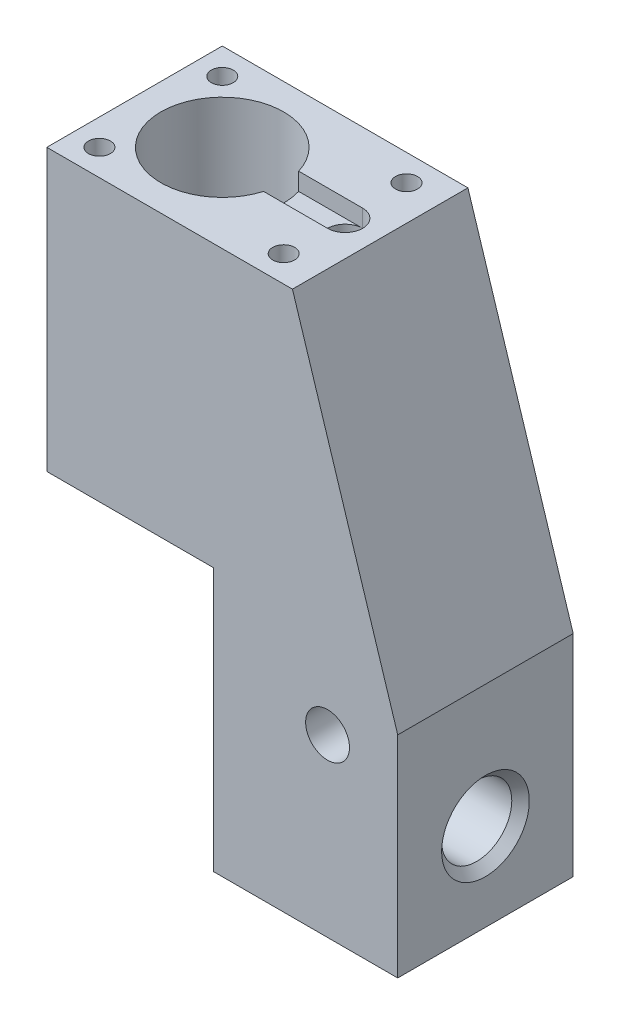
from build123d import *

# Parameters (mm, degrees)
BOSS_EXTRUDE1_DEPTH     = 10
CUT_EXTRUDE1_DEPTH      = 67.219333
CUT_EXTRUDE2_DEPTH      = 2
M3_TAPPED_HOLE1_D       = 2.5
M3_TAPPED_HOLE1_DEPTH   = 9
M3_TAPPED_HOLE1_TIP     = 0.751076
SKETCH5_R               = 2.5
CUT_EXTRUDE3_DEPTH      = 44.185646
SKETCH6_R               = 4
CUT_EXTRUDE4_DEPTH      = 53.191953
CHAMFER1_SIZE           = 1
HOLE1_OUTLINE_R         = 2
HOLE1_DEPTH             = 30
HOLE1_START             = -16.200329
HOLE1_2_OUTLINE_R       = 1.25
HOLE1_2_DEPTH           = 16.200329
CUT_EXTRUDE5_REACH      = 54.192
CUT_EXTRUDE5_END_RADIUS = 7
SKETCH9_R               = 1.6
M4_TAPPED_HOLE1_REACH   = 68.219
M4_TAPPED_HOLE1_BORE_R  = 1.65
CUT_EXTRUDE6_REACH      = 68.219
CUT_EXTRUDE6_END_RADIUS = 2.5
SKETCH13_R              = 1.25


# Read off the part's stored shape, not the designer's step: Hole1
with BuildPart() as part:
    # Sketch1 → Boss-Extrude1 (new, symmetric)
    with BuildSketch(Plane.XY):
        Polygon((0, 0), (-19, 0), (-19, 32), (9, 32), (21, -6), (21, -30), (0, -30), align=None)
    extrude(amount=BOSS_EXTRUDE1_DEPTH, both=True)

    # Sketch2 → Cut-Extrude1 (cut, through all)
    with BuildSketch(Plane(origin=(0, 32, 0), x_dir=(1, 0, 0), z_dir=(0, 1, 0))):
        with BuildLine():
            ThreePointArc((-2.291796, 2), (-10.010587, 6.926667), (-16, 0))
            Line((-16, 0), (-2, 0))
            ThreePointArc((-2, 0), (-2.073333, 1.010587), (-2.291796, 2))
        make_face()
        with BuildLine():
            Line((-2, 0), (-16, 0))
            ThreePointArc((-16, 0), (-10.010587, -6.926667), (-2.291796, -2))
            ThreePointArc((-2.291796, -2), (-2.073333, -1.010587), (-2, 0))
        make_face()
    extrude(amount=-CUT_EXTRUDE1_DEPTH, mode=Mode.SUBTRACT)

    # Sketch2<3> → Cut-Extrude2 (cut)
    with BuildSketch(Plane(origin=(0, 32, 0), x_dir=(1, 0, 0), z_dir=(0, 1, 0))):
        with BuildLine():
            ThreePointArc((-2.291796, 2), (-2.073333, 1.010587), (-2, 0))
            Line((-2, 0), (3, 0))
            ThreePointArc((3, 0), (3.585786, 1.414214), (5, 2))
            Line((5, 2), (-2.291796, 2))
        make_face()
        with BuildLine():
            Line((3, 0), (-2, 0))
            ThreePointArc((-2, 0), (-2.073333, -1.010587), (-2.291796, -2))
            Line((-2.291796, -2), (5, -2))
            ThreePointArc((5, -2), (3.585786, -1.414214), (3, 0))
        make_face()
        with BuildLine():
            ThreePointArc((5, 2), (3.585786, 1.414214), (3, 0))
            Line((3, 0), (7, 0))
            ThreePointArc((7, 0), (6.414214, 1.414214), (5, 2))
        make_face()
        with BuildLine():
            Line((7, 0), (3, 0))
            ThreePointArc((3, 0), (3.585786, -1.414214), (5, -2))
            ThreePointArc((5, -2), (6.414214, -1.414214), (7, 0))
        make_face()
    extrude(amount=-CUT_EXTRUDE2_DEPTH, mode=Mode.SUBTRACT)

    # M3 Tapped Hole1
    with Locations(Plane(origin=(0, 32, 0), x_dir=(1, 0, 0), z_dir=(0, 1, 0))):
        with Locations((-16, 7), (-16, -7), (5, -7), (5, 7)):
            Hole(M3_TAPPED_HOLE1_D / 2, depth=M3_TAPPED_HOLE1_DEPTH)
            with Locations((0, 0, -(M3_TAPPED_HOLE1_DEPTH + M3_TAPPED_HOLE1_TIP / 2))):  # 118° drill point
                Cone(0, M3_TAPPED_HOLE1_D / 2, M3_TAPPED_HOLE1_TIP, mode=Mode.SUBTRACT)

    # Sketch5 → Cut-Extrude3 (cut, through all)
    with BuildSketch(Plane.XY.offset(10)):
        with Locations((13, -10)):
            Circle(SKETCH5_R)
    extrude(amount=-CUT_EXTRUDE3_DEPTH, mode=Mode.SUBTRACT)

    # Sketch6 → Cut-Extrude4 (cut, through all)
    with BuildSketch(Plane(origin=(21, 0, 0), x_dir=(0, 0, -1), z_dir=(1, 0, 0))):
        with Locations((0, -20)):
            Circle(SKETCH6_R)
    extrude(amount=-CUT_EXTRUDE4_DEPTH, mode=Mode.SUBTRACT)

    # Chamfer1
    chamfer1_edges = [part.edges().sort_by_distance(p)[0] for p in [
        (21, -20, 4),
    ]]
    chamfer(chamfer1_edges, length=CHAMFER1_SIZE)

    # Hole1 outline → Hole1 (cut)
    with BuildSketch(Plane(origin=(0, 0, 0), x_dir=(1, 0, 0), z_dir=(0, 1, 0))):
        with Locations((5, 0)):
            Circle(HOLE1_OUTLINE_R)
    extrude(amount=HOLE1_DEPTH, mode=Mode.SUBTRACT)

    # Hole1 2 outline → Hole1 2 (cut)
    with BuildSketch(Plane(origin=(0, 0, 0), x_dir=(1, 0, 0), z_dir=(0, 1, 0)).offset(HOLE1_START)):
        with Locations((5, 0)):
            Circle(HOLE1_2_OUTLINE_R)
    extrude(amount=HOLE1_2_DEPTH, mode=Mode.SUBTRACT)

    # Cut-Extrude5: up to this cylinder (the profile starts outside it)
    cut_extrude5_end = Plane(origin=(-9, 15, 0), z_dir=(0, 1, 0)) * Cylinder(CUT_EXTRUDE5_END_RADIUS, 123.384, mode=Mode.PRIVATE)
    # Sketch9 → Cut-Extrude5 (cut, up to the surface)
    with BuildSketch(Plane.ZY.offset(19), mode=Mode.PRIVATE) as cut_extrude5_sk1:
        with Locations(Location((-3, 15, 0), (0, 0, 270))):
            Circle(SKETCH9_R)
    cut_extrude5_tool1 = extrude(cut_extrude5_sk1.sketch, amount=-CUT_EXTRUDE5_REACH, mode=Mode.PRIVATE) - cut_extrude5_end
    add(cut_extrude5_tool1.solids().sort_by_distance((-19, 15, -3))[0], mode=Mode.SUBTRACT)
    # Sketch9 → Cut-Extrude5 (cut, up to the surface)
    with BuildSketch(Plane.ZY.offset(19), mode=Mode.PRIVATE) as cut_extrude5_sk2:
        with Locations(Location((3, 15, 0), (0, 0, 270))):
            Circle(SKETCH9_R)
    cut_extrude5_tool2 = extrude(cut_extrude5_sk2.sketch, amount=-CUT_EXTRUDE5_REACH, mode=Mode.PRIVATE) - cut_extrude5_end
    add(cut_extrude5_tool2.solids().sort_by_distance((-19, 15, 3))[0], mode=Mode.SUBTRACT)

    # M4 Tapped Hole1 bore → M4 Tapped Hole1 (cut, up to next)
    with BuildSketch(Plane(origin=(0, -30, 0), x_dir=(-1, 0, 0), z_dir=(0, -1, 0)), mode=Mode.PRIVATE) as m4_tapped_hole1_sk1:
        with Locations((-5, 0)):
            Circle(M4_TAPPED_HOLE1_BORE_R)
    m4_tapped_hole1_tool1 = extrude(m4_tapped_hole1_sk1.sketch, amount=-M4_TAPPED_HOLE1_REACH, mode=Mode.PRIVATE) & part.part
    # M4 Tapped Hole1 bore → M4 Tapped Hole1 (cut, up to next)
    with BuildSketch(Plane(origin=(0, -30, 0), x_dir=(-1, 0, 0), z_dir=(0, -1, 0)), mode=Mode.PRIVATE) as m4_tapped_hole1_sk2:
        with Locations((-13, 0)):
            Circle(M4_TAPPED_HOLE1_BORE_R)
    m4_tapped_hole1_tool2 = extrude(m4_tapped_hole1_sk2.sketch, amount=-M4_TAPPED_HOLE1_REACH, mode=Mode.PRIVATE) & part.part
    add(m4_tapped_hole1_tool1.solids().sort_by_distance((5, -30, 0))[0], mode=Mode.SUBTRACT)
    add(m4_tapped_hole1_tool2.solids().sort_by_distance((13, -30, 0))[0], mode=Mode.SUBTRACT)

    # Cut-Extrude6: up to this cylinder (the profile starts outside it)
    cut_extrude6_end = Plane(origin=(13, -10, 0), z_dir=(0, 0, 1)) * Cylinder(CUT_EXTRUDE6_END_RADIUS, 142.438, mode=Mode.PRIVATE)
    # Sketch13 → Cut-Extrude6 (cut, up to the surface)
    with BuildSketch(Plane.XZ.offset(30), mode=Mode.PRIVATE) as cut_extrude6_sk1:
        with Locations(Location((13, 0, 0), (0, 0, 270))):
            Circle(SKETCH13_R)
    cut_extrude6_tool1 = extrude(cut_extrude6_sk1.sketch, amount=-CUT_EXTRUDE6_REACH, mode=Mode.PRIVATE) - cut_extrude6_end
    add(cut_extrude6_tool1.solids().sort_by_distance((13, -30, 0))[0], mode=Mode.SUBTRACT)


solid = part.part
